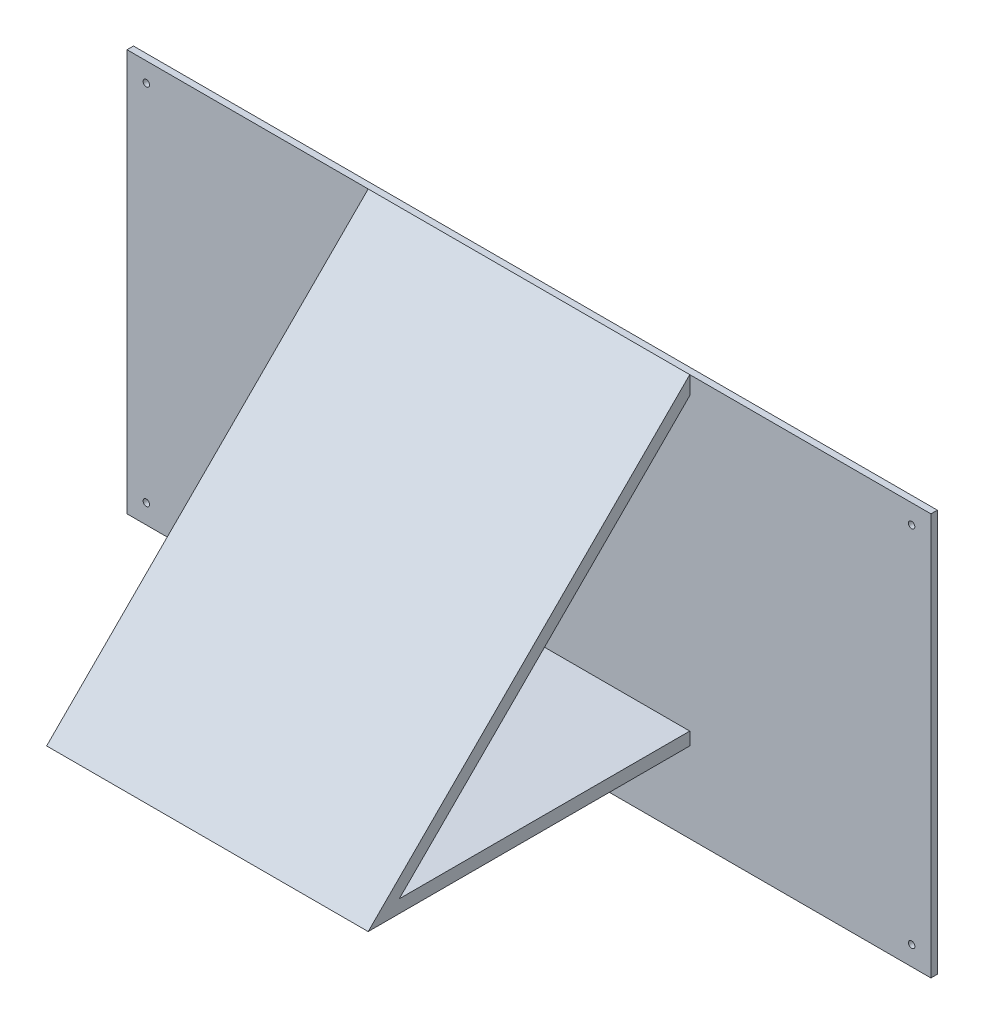
from build123d import *

# Parameters (mm, degrees)
SKIZZE1_W                       = 250
SKIZZE1_H                       = 125
AUFSATZ_LINEAR_AUSTRAGEN1_DEPTH = 2
SKIZZE2_W                       = 100
SKIZZE2_H                       = 100
AUFSATZ_LINEAR_AUSTRAGEN2_DEPTH = 100
SCHNITT_LINEAR_AUSTRAGEN1_DEPTH = 100
SCHNITT_LINEAR_AUSTRAGEN2_DEPTH = 100
SKIZZE6_W                       = 242
SKIZZE6_H                       = 117
AUFSATZ_LINEAR_AUSTRAGEN3_DEPTH = 2
SKIZZE7_R                       = 1
SCHNITT_LINEAR_AUSTRAGEN5_DEPTH = 32


with BuildPart() as part:
    # Skizze1 → Aufsatz-Linear austragen1 (new body)
    with BuildSketch(Plane.XY):
        with Locations((125, 62.5)):
            Rectangle(SKIZZE1_W, SKIZZE1_H)
    extrude(amount=AUFSATZ_LINEAR_AUSTRAGEN1_DEPTH)

    # Skizze2 → Aufsatz-Linear austragen2 (add)
    with BuildSketch(Plane.XY.offset(2)):
        with Locations((125, 75)):
            Rectangle(SKIZZE2_W, SKIZZE2_H)
    extrude(amount=AUFSATZ_LINEAR_AUSTRAGEN2_DEPTH)

    # Skizze3 → Schnitt-Linear austragen1 (cut)
    with BuildSketch(Plane.ZY.offset(-75)):
        Polygon((102, 25), (102, 125), (2, 125), align=None)
    extrude(amount=-SCHNITT_LINEAR_AUSTRAGEN1_DEPTH, mode=Mode.SUBTRACT)

    # Skizze4 → Schnitt-Linear austragen2 (cut)
    with BuildSketch(Plane.ZY.offset(-75)):
        Polygon((2, 119.343145751), (92.343145751, 29), (2, 29), align=None)
    extrude(amount=-SCHNITT_LINEAR_AUSTRAGEN2_DEPTH, mode=Mode.SUBTRACT)

    # Skizze6 → Aufsatz-Linear austragen3 (add)
    with BuildSketch(Plane(origin=(0, 0, 0), x_dir=(-1, 0, 0), z_dir=(0, 0, -1))):
        with Locations((-125, 62.5)):
            Rectangle(SKIZZE6_W, SKIZZE6_H)
    extrude(amount=AUFSATZ_LINEAR_AUSTRAGEN3_DEPTH)

    # Skizze7 → Schnitt-Linear austragen5 (cut)
    with BuildSketch(Plane(origin=(0, 0, -2), x_dir=(-1, 0, 0), z_dir=(0, 0, -1))):
        with Locations((-244, 119)):
            Circle(SKIZZE7_R)
        with Locations((-6, 6)):
            Circle(SKIZZE7_R)
        with Locations((-6, 119)):
            Circle(SKIZZE7_R)
        with Locations((-244, 6)):
            Circle(SKIZZE7_R)
    extrude(amount=-SCHNITT_LINEAR_AUSTRAGEN5_DEPTH, mode=Mode.SUBTRACT)


solid = part.part
